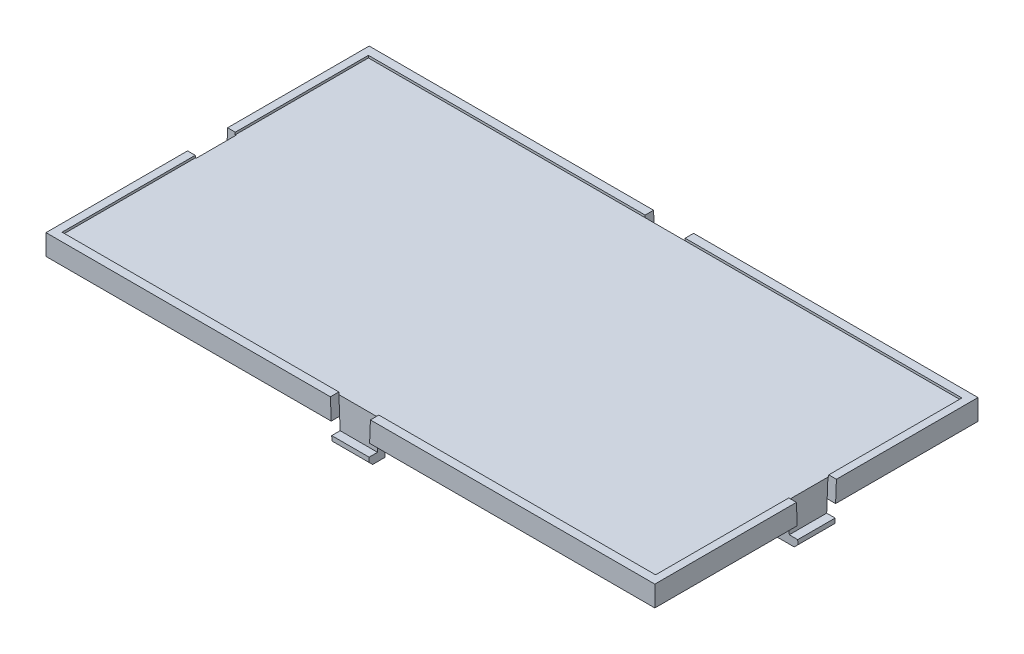
from build123d import *

# Parameters (mm, degrees)
SKETCH_1_W          = 79.5
SKETCH_1_H          = 42.2
EXTRUDE_1_DEPTH     = 2.7
SKETCH_2_W          = 77.5
SKETCH_2_H          = 40
CUT_EXTRUDE_1_DEPTH = 0.3
SKETCH_3_W          = 74.4
SKETCH_3_H          = 38
CUT_EXTRUDE_2_DEPTH = 0.3
EXTRUDE_2_DEPTH     = 2.65
CUT_EXTRUDE_4_DEPTH = 1.1
CUT_EXTRUDE_5_DEPTH = 3
EXTRUDE_3_DEPTH     = 2.1
CUT_EXTRUDE_6_DEPTH = 1.1
CUT_EXTRUDE_7_DEPTH = 3


with BuildPart() as part:
    # Эскиз1 → Бобышка-Вытянуть1 (new body)
    with BuildSketch(Plane(origin=(0, 0, 0), x_dir=(1, 0, 0), z_dir=(0, 1, 0))):
        Rectangle(SKETCH_1_W, SKETCH_1_H)
    extrude(amount=EXTRUDE_1_DEPTH)

    # Эскиз2 → Вырез-Вытянуть1 (cut)
    with BuildSketch(Plane(origin=(0, 2.7, 0), x_dir=(1, 0, 0), z_dir=(0, 1, 0))):
        Rectangle(SKETCH_2_W, SKETCH_2_H)
    extrude(amount=-CUT_EXTRUDE_1_DEPTH, mode=Mode.SUBTRACT)

    # Эскиз3 → Вырез-Вытянуть2 (cut)
    with BuildSketch(Plane.XZ):
        Rectangle(SKETCH_3_W, SKETCH_3_H)
    extrude(amount=-CUT_EXTRUDE_2_DEPTH, mode=Mode.SUBTRACT)

    # Эскиз4 → Бобышка-Вытянуть2 (add)
    with BuildSketch(Plane.ZY.offset(39.75)):
        Polygon((-2.6, 2.4), (2.6, 2.4), (2.4, -2.7), (-2.4, -2.7), align=None)
    extrude_2 = extrude(amount=-EXTRUDE_2_DEPTH)

    # Эскиз5 → Вырез-Вытянуть4 (cut)
    with BuildSketch(Plane.ZY.offset(39.75)):
        Polygon((-2.443137255, -1.6), (2.443137255, -1.6), (2.611764706, 2.7), (-2.611764706, 2.7), align=None)
    cut_extrude_4 = extrude(amount=-CUT_EXTRUDE_4_DEPTH, mode=Mode.SUBTRACT)

    # Эскиз6 → Вырез-Вытянуть5 (cut, symmetric)
    with BuildSketch(Plane.XY):
        Polygon((-39.75, -2.2), (-39.75, -2.7), (-39.25, -2.7), align=None)
    cut_extrude_5 = extrude(amount=CUT_EXTRUDE_5_DEPTH, both=True, mode=Mode.SUBTRACT)

    # Эскиз7 → Бобышка-Вытянуть3 (add)
    with BuildSketch(Plane.XY.offset(21.1)):
        Polygon((-2.6, 2.4), (2.6, 2.4), (2.4, -2.7), (-2.4, -2.7), align=None)
    extrude_3 = extrude(amount=-EXTRUDE_3_DEPTH)

    # Эскиз8 → Вырез-Вытянуть6 (cut)
    with BuildSketch(Plane.XY.offset(21.1)):
        Polygon((-2.443137255, -1.6), (-2.611764706, 2.7), (2.611764706, 2.7), (2.443137255, -1.6), align=None)
    cut_extrude_6 = extrude(amount=-CUT_EXTRUDE_6_DEPTH, mode=Mode.SUBTRACT)

    # Эскиз9 → Вырез-Вытянуть7 (cut, symmetric)
    with BuildSketch(Plane(origin=(0, -54.3, 0), x_dir=(0, 0, -1), z_dir=(1, 0, 0))):
        Polygon((-21.1, 51.6), (-21.1, 52.1), (-20.6, 51.6), align=None)
    cut_extrude_7 = extrude(amount=CUT_EXTRUDE_7_DEPTH, both=True, mode=Mode.SUBTRACT)

    # Зеркальное отражение3: Бобышка-Вытянуть3, Вырез-Вытянуть6, Вырез-Вытянуть7 across plane
    add(extrude_3.mirror(Plane.XY))
    add(cut_extrude_6.mirror(Plane.XY), mode=Mode.SUBTRACT)
    add(cut_extrude_7.mirror(Plane.XY), mode=Mode.SUBTRACT)

    # Зеркальное отражение4: Бобышка-Вытянуть2, Вырез-Вытянуть4, Вырез-Вытянуть5 across plane
    add(extrude_2.mirror(Plane(origin=(0, 0, 0), x_dir=(0, 0, 1), z_dir=(1, 0, 0))))
    add(cut_extrude_4.mirror(Plane(origin=(0, 0, 0), x_dir=(0, 0, 1), z_dir=(1, 0, 0))), mode=Mode.SUBTRACT)
    add(cut_extrude_5.mirror(Plane(origin=(0, 0, 0), x_dir=(0, 0, 1), z_dir=(1, 0, 0))), mode=Mode.SUBTRACT)


solid = part.part
